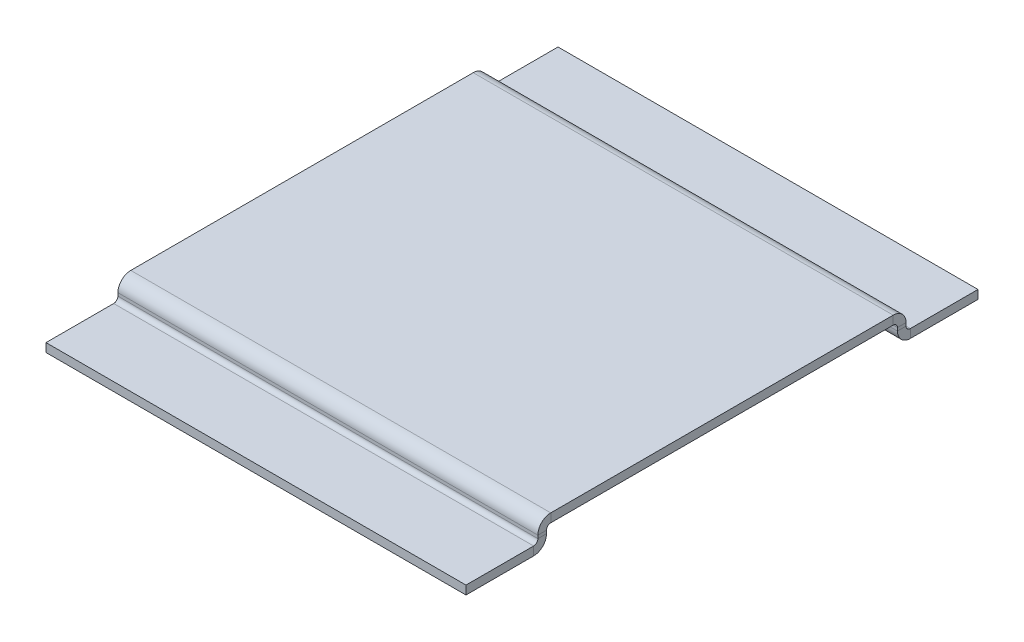
from build123d import *

# Parameters (mm, degrees)
SKETCH1_W                      = 73
SKETCH1_H                      = 64
BASE_FLANGE1_DEPTH             = 1.5
EDGE_FLANGE1_STRIP_W           = 7.4732
EDGE_FLANGE1_STRIP_H           = 1.5
EDGE_FLANGE1_STRIP_CUT_DEPTH   = 73
EDGE_FLANGE1_STRIP_2_W         = 7.4732
EDGE_FLANGE1_STRIP_2_H         = 1.5
EDGE_FLANGE1_STRIP_CUT_2_DEPTH = 73
EDGE_FLANGE1_DEPTH             = 73
EDGE_FLANGE1_BEND_DEPTH        = 73
EDGE_FLANGE2_STRIP_W           = 7.4732
EDGE_FLANGE2_STRIP_H           = 1.5
EDGE_FLANGE2_STRIP_CUT_DEPTH   = 73
EDGE_FLANGE2_STRIP_2_W         = 7.4732
EDGE_FLANGE2_STRIP_2_H         = 1.5
EDGE_FLANGE2_STRIP_CUT_2_DEPTH = 73
EDGE_FLANGE2_DEPTH             = 73
EDGE_FLANGE2_BEND_DEPTH        = 73


# Sheet-metal steps are written as plain solids
with BuildPart() as part:
    # Sketch1 → Base-Flange1 (new body)
    with BuildSketch(Plane(origin=(0, 0, 0), x_dir=(1, 0, 0), z_dir=(0, 1, 0))):
        Rectangle(SKETCH1_W, SKETCH1_H)
    extrude(amount=-BASE_FLANGE1_DEPTH)

    # Edge-Flange1 strip (across the edge) → Edge-Flange1 strip cut (cut)
    with BuildSketch(Plane(origin=(36.5, -1.5, 32), x_dir=(0, 0, -1), z_dir=(-1, 0, 0))):
        with Locations((-1.5, -0.75)):
            Rectangle(EDGE_FLANGE1_STRIP_W, EDGE_FLANGE1_STRIP_H)
    extrude(amount=EDGE_FLANGE1_STRIP_CUT_DEPTH, mode=Mode.SUBTRACT)

    # Edge-Flange1 strip 2 (across the edge) → Edge-Flange1 strip cut 2 (cut)
    with BuildSketch(Plane(origin=(-36.5, -1.5, -32), x_dir=(0, 0, 1), z_dir=(1, 0, 0))):
        with Locations((-1.5, -0.75)):
            Rectangle(EDGE_FLANGE1_STRIP_2_W, EDGE_FLANGE1_STRIP_2_H)
    extrude(amount=EDGE_FLANGE1_STRIP_CUT_2_DEPTH, mode=Mode.SUBTRACT)

    # Edge-Flange1 section (across the edge) → Edge-Flange1 (add)
    with BuildSketch(Plane(origin=(36.5, -1.5, 32), x_dir=(0, 0, -1), z_dir=(-1, 0, 0))):
        with BuildLine():
            Line((0, 0.7366), (0, 3.5))
            Line((0, 3.5), (1.5, 3.5))
            Line((1.5, 3.5), (1.5, 0.7366))
            ThreePointArc((1.5, 0.7366), (1.715745145, 0.215745145), (2.2366, 0))
            Line((2.2366, 0), (2.2366, -1.5))
            ThreePointArc((2.2366, -1.5), (0.655084973, -0.844915027), (0, 0.7366))
        make_face()
    extrude(amount=EDGE_FLANGE1_DEPTH)

    # Edge-Flange1 section 2 (across the edge) → Edge-Flange1 bend (add)
    with BuildSketch(Plane(origin=(-36.5, -1.5, -32), x_dir=(0, 0, 1), z_dir=(1, 0, 0))):
        with BuildLine():
            Line((0, 0.7366), (0, 3.5))
            Line((0, 3.5), (1.5, 3.5))
            Line((1.5, 3.5), (1.5, 0.7366))
            ThreePointArc((1.5, 0.7366), (1.715745145, 0.215745145), (2.2366, 0))
            Line((2.2366, 0), (2.2366, -1.5))
            ThreePointArc((2.2366, -1.5), (0.655084973, -0.844915027), (0, 0.7366))
        make_face()
    extrude(amount=EDGE_FLANGE1_BEND_DEPTH)

    # Edge-Flange2 strip (across the edge) → Edge-Flange2 strip cut (cut)
    with BuildSketch(Plane(origin=(-36.5, -5, 32), x_dir=(0, 1, 0), z_dir=(1, 0, 0))):
        with Locations((-1.5, -0.75)):
            Rectangle(EDGE_FLANGE2_STRIP_W, EDGE_FLANGE2_STRIP_H)
    extrude(amount=EDGE_FLANGE2_STRIP_CUT_DEPTH, mode=Mode.SUBTRACT)

    # Edge-Flange2 strip 2 (across the edge) → Edge-Flange2 strip cut 2 (cut)
    with BuildSketch(Plane(origin=(36.5, -5, -32), x_dir=(0, 1, 0), z_dir=(-1, 0, 0))):
        with Locations((-1.5, -0.75)):
            Rectangle(EDGE_FLANGE2_STRIP_2_W, EDGE_FLANGE2_STRIP_2_H)
    extrude(amount=EDGE_FLANGE2_STRIP_CUT_2_DEPTH, mode=Mode.SUBTRACT)

    # Edge-Flange2 section (across the edge) → Edge-Flange2 (add)
    with BuildSketch(Plane(origin=(-36.5, -5, 32), x_dir=(0, 1, 0), z_dir=(1, 0, 0))):
        with BuildLine():
            Line((0, 0.7366), (0, 12.5))
            Line((0, 12.5), (1.5, 12.5))
            Line((1.5, 12.5), (1.5, 0.7366))
            ThreePointArc((1.5, 0.7366), (1.715745145, 0.215745145), (2.2366, 0))
            Line((2.2366, 0), (2.2366, -1.5))
            ThreePointArc((2.2366, -1.5), (0.655084973, -0.844915027), (0, 0.7366))
        make_face()
    extrude(amount=EDGE_FLANGE2_DEPTH)

    # Edge-Flange2 section 2 (across the edge) → Edge-Flange2 bend (add)
    with BuildSketch(Plane(origin=(36.5, -5, -32), x_dir=(0, 1, 0), z_dir=(-1, 0, 0))):
        with BuildLine():
            Line((0, 0.7366), (0, 12.5))
            Line((0, 12.5), (1.5, 12.5))
            Line((1.5, 12.5), (1.5, 0.7366))
            ThreePointArc((1.5, 0.7366), (1.715745145, 0.215745145), (2.2366, 0))
            Line((2.2366, 0), (2.2366, -1.5))
            ThreePointArc((2.2366, -1.5), (0.655084973, -0.844915027), (0, 0.7366))
        make_face()
    extrude(amount=EDGE_FLANGE2_BEND_DEPTH)


solid = part.part
